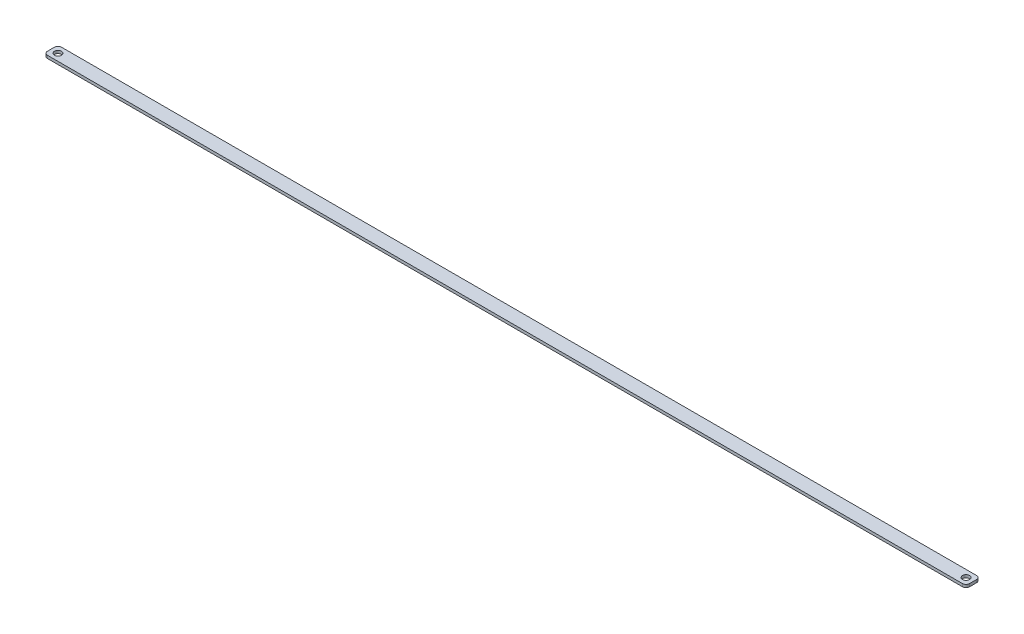
from build123d import *

# Parameters (mm, degrees)
SKETCH1_R           = 2.5
BOSS_EXTRUDE2_DEPTH = 2
FLEX1_OUTLINE_R     = 2.5
FLEX1_DEPTH         = 2


# Read off the part's stored shape, not the designer's step: Flex1
with BuildPart() as part:
    # Sketch1 → Boss-Extrude2 (new body)
    with BuildSketch(Plane(origin=(0, 0, 0), x_dir=(1, 0, 0), z_dir=(0, 1, 0))):
        with BuildLine():
            Line((2.5, 0), (47.5, 0))
            ThreePointArc((47.5, 0), (49.267766953, 0.732233047), (50, 2.5))
            Line((50, 2.5), (50, 7.5))
            ThreePointArc((50, 7.5), (49.267766953, 9.267766953), (47.5, 10))
            Line((47.5, 10), (2.5, 10))
            ThreePointArc((2.5, 10), (0.732233047, 9.267766953), (0, 7.5))
            Line((0, 7.5), (0, 2.5))
            ThreePointArc((0, 2.5), (0.732233047, 0.732233047), (2.5, 0))
        make_face()
        with Locations(Location((5, 5, 0), (0, 0, 270))):
            Circle(SKETCH1_R, mode=Mode.SUBTRACT)
        with Locations(Location((45, 5, 0), (0, 0, 270))):
            Circle(SKETCH1_R, mode=Mode.SUBTRACT)
    extrude(amount=BOSS_EXTRUDE2_DEPTH)

    # Flex1 outline → Flex1 (add)
    # profile 1 of 4: a face of its own
    with BuildSketch(Plane(origin=(0, 0, 0), x_dir=(1, 0, 0), z_dir=(0, 1, 0))):
        with BuildLine():
            Line((2.5, 10), (-293.670539746, 10))
            ThreePointArc((-293.670539746, 10), (-295.438306699, 9.267766953), (-296.170539746, 7.5))
            Line((-296.170539746, 7.5), (-296.170539746, 2.5))
            ThreePointArc((-296.170539746, 2.5), (-295.438306699, 0.732233047), (-293.670539746, 0))
            Line((-293.670539746, 0), (2.5, 0))
            ThreePointArc((2.5, 0), (0.732233047, 0.732233047), (0, 2.5))
            Line((0, 2.5), (0, 7.5))
            ThreePointArc((0, 7.5), (0.732233047, 9.267766953), (2.5, 10))
        make_face()
        with Locations((-291.170539746, 5)):
            Circle(FLEX1_OUTLINE_R, mode=Mode.SUBTRACT)
    # profile 2 of 4: a face of its own
    with BuildSketch(Plane(origin=(0, 0, 0), x_dir=(1, 0, 0), z_dir=(0, 1, 0))):
        with BuildLine():
            Line((358.329460254, 10), (47.5, 10))
            ThreePointArc((47.5, 10), (49.267766953, 9.267766953), (50, 7.5))
            Line((50, 7.5), (50, 2.5))
            ThreePointArc((50, 2.5), (49.267766953, 0.732233047), (47.5, 0))
            Line((47.5, 0), (358.329460254, 0))
            ThreePointArc((358.329460254, 0), (360.097227207, 0.732233047), (360.829460254, 2.5))
            Line((360.829460254, 2.5), (360.829460254, 7.5))
            ThreePointArc((360.829460254, 7.5), (360.097227207, 9.267766953), (358.329460254, 10))
        make_face()
        with Locations((355.829460254, 5)):
            Circle(FLEX1_OUTLINE_R, mode=Mode.SUBTRACT)
    # profile 3 of 4: a face of its own
    with BuildSketch(Plane(origin=(0, 0, 0), x_dir=(1, 0, 0), z_dir=(0, 1, 0))):
        with Locations((5, 5)):
            Circle(FLEX1_OUTLINE_R)
    # profile 4 of 4: a face of its own
    with BuildSketch(Plane(origin=(0, 0, 0), x_dir=(1, 0, 0), z_dir=(0, 1, 0))):
        with Locations((45, 5)):
            Circle(FLEX1_OUTLINE_R)
    extrude(amount=FLEX1_DEPTH)


solid = part.part
